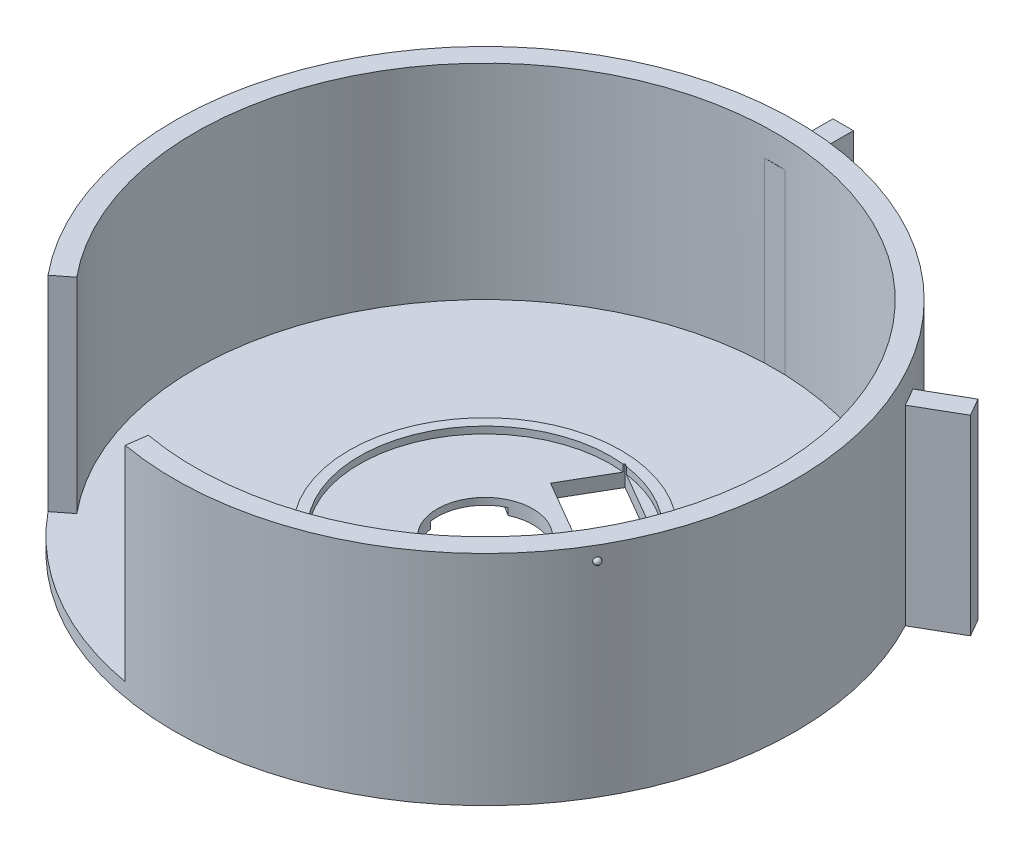
from build123d import *

# Parameters (mm, degrees)
SKETCH1_R                = 45.5
SKETCH1_R_2              = 42.5
BOSS_EXTRUDE1_DEPTH      = 32
SKETCH2_R                = 45.5
BOSS_EXTRUDE2_DEPTH      = 2
SKETCH3_R                = 7
CUT_EXTRUDE1_DEPTH       = 2
BOSS_EXTRUDE4_DEPTH      = 26
BOSS_EXTRUDE4_DEPTH_BACK = 2
SKETCH7_W                = 3
SKETCH7_H                = 10
SKETCH8_R                = 19.890165718
SKETCH8_R_2              = 18.390165718
BOSS_EXTRUDE5_DEPTH      = 1
CUT_EXTRUDE4_DEPTH       = 5.5
CUT_EXTRUDE5_DEPTH       = 58.5
CUT_EXTRUDE6_DEPTH       = 1
BOSS_EXTRUDE6_DEPTH      = 0.5
BOSS_EXTRUDE6_DEPTH_BACK = 2
SKETCH13_R               = 0.5
FILLET1_R                = 0.5
BOSS_EXTRUDE7_START      = -2
SKETCH23_R               = 0.5
BOSS_EXTRUDE7_DEPTH      = 2.5
FILLET2_R                = 0.5
FILLET2_OF_MIRROR1_R     = 0.5


with BuildPart() as part:
    # Sketch1 → Boss-Extrude1 (new body)
    with BuildSketch(Plane(origin=(0, 0, 0), x_dir=(1, 0, 0), z_dir=(0, 1, 0))):
        with Locations(Location((0, 0, 0), (0, 0, 270))):
            Circle(SKETCH1_R)
        with Locations(Location((0, 0, 0), (0, 0, 270))):
            Circle(SKETCH1_R_2, mode=Mode.SUBTRACT)
    extrude(amount=BOSS_EXTRUDE1_DEPTH)

    # Sketch2 → Boss-Extrude2 (add)
    with BuildSketch(Plane.XZ):
        with Locations(Location((0, 0, 0), (0, 0, 90))):
            Circle(SKETCH2_R)
    extrude(amount=-BOSS_EXTRUDE2_DEPTH)

    # Sketch3 → Cut-Extrude1 (cut)
    with BuildSketch(Plane(origin=(0, 2, 0), x_dir=(1, 0, 0), z_dir=(0, 1, 0))):
        with Locations(Location((0, 0, 0), (0, 0, 270))):
            Circle(SKETCH3_R)
    extrude(amount=-CUT_EXTRUDE1_DEPTH, mode=Mode.SUBTRACT)

    # Sketch7 → Boss-Extrude4 (add, two sides: drawn at the far end of the back side and taken through both)
    with BuildSketch(Plane(origin=(0, 2, 0), x_dir=(1, 0, 0), z_dir=(0, 1, 0)).offset(-BOSS_EXTRUDE4_DEPTH_BACK)):
        with Locations((0, 47.473521163)):
            Rectangle(SKETCH7_W, SKETCH7_H)
        Polygon((46.193402353, 24.937722476), (37.533148315, 19.937722476), (36.033148315, 22.535798687), (44.693402353, 27.535798687), align=None)
    extrude(amount=BOSS_EXTRUDE4_DEPTH + BOSS_EXTRUDE4_DEPTH_BACK)

    # Sketch8 → Boss-Extrude5 (add)
    with BuildSketch(Plane(origin=(0, 2, 0), x_dir=(1, 0, 0), z_dir=(0, 1, 0))):
        with Locations(Location((0, 0, 0), (0, 0, 90))):
            Circle(SKETCH8_R)
        with Locations(Location((0, 0, 0), (0, 0, 270))):
            Circle(SKETCH8_R_2, mode=Mode.SUBTRACT)
    extrude(amount=BOSS_EXTRUDE5_DEPTH)

    # Sketch10 → Cut-Extrude4 (cut)
    with BuildSketch(Plane.XZ):
        Polygon((2.06668842, -18.465611254), (15.0318685, -10.92213026), (11.008678636, -4.007367551), (-1.956501443, -11.550848545), align=None)
    extrude(amount=-CUT_EXTRUDE4_DEPTH, mode=Mode.SUBTRACT)

    # Sketch11 → Cut-Extrude5 (cut)
    with BuildSketch(Plane(origin=(0, 2, 0), x_dir=(1, 0, 0), z_dir=(0, 1, 0))):
        Polygon((-32.606600292, -26.874098434), (-35.165226496, -28.87311631), (-33.824988888, -37.754161376), (-11.7382848, -48.772412552), (-7.925983096, -44.804338986), (-7.495155029, -41.738838001), (-9.978475631, -35.419229659), (-25.965270809, -26.874098434), align=None)
    extrude(amount=CUT_EXTRUDE5_DEPTH, mode=Mode.SUBTRACT)

    # Sketch12 → Cut-Extrude6 (cut)
    with BuildSketch(Plane.XZ):
        Polygon((-6.912265346, 1.104802147), (-24.20763883, -9.480307189), (-19.814483018, -16.658435267), (-2.519109534, -6.073325931), align=None)
    extrude(amount=-CUT_EXTRUDE6_DEPTH, mode=Mode.SUBTRACT)

    # Sketch23 → Boss-Extrude7 (add)
    with BuildSketch(Plane(origin=(39.327712908, 0, 22.881892348), x_dir=(0.5028987329328956, 0, -0.8643453386317811), z_dir=(0.8643453386317811, 0, 0.5028987329328956)).offset(BOSS_EXTRUDE7_START)):
        with Locations((0, 30)):
            Circle(SKETCH23_R)
    boss_extrude7 = extrude(amount=BOSS_EXTRUDE7_DEPTH)

    # Fillet2
    fillet2_edges = [part.edges().sort_by_distance(p)[0] for p in [
        (39.508436211, 30, 23.565514384),
    ]]
    fillet(fillet2_edges, radius=FILLET2_R - 0.0001)  # a hair under: the kernel refuses the full size

    # Mirror1: Boss-Extrude7 across plane
    add(boss_extrude7.mirror(Plane(origin=(0, 0, 0), x_dir=(-0.5028987329328956, 0, 0.864345338631781), z_dir=(0.8643453386317811, 0, 0.5028987329328956))))

    # Fillet2 of Mirror1
    fillet2_of_mirror1_edges = [part.edges().sort_by_distance(p)[0] for p in [
        (-40.011334944, 30, -22.701169046),
    ]]
    fillet(fillet2_of_mirror1_edges, radius=FILLET2_OF_MIRROR1_R - 0.0001)  # a hair under: the kernel refuses the full size


with BuildPart() as body_2:
    # Sketch13 → Boss-Extrude6 (new, two sides: drawn at the far end of the back side and taken through both)
    with BuildSketch(Plane(origin=(22.831602475, 0, -39.241278374), x_dir=(-0.8643453386317811, 0, -0.5028987329328956), z_dir=(0.5028987329328954, 0, -0.864345338631781)).offset(-BOSS_EXTRUDE6_DEPTH_BACK)):
        with Locations((0, 30)):
            Circle(SKETCH13_R)
    extrude(amount=BOSS_EXTRUDE6_DEPTH + BOSS_EXTRUDE6_DEPTH_BACK)

    # Fillet1
    fillet1_edges = [body_2.edges().sort_by_distance(p)[0] for p in [
        (23.515224511, 30, -39.422001677),
    ]]
    fillet(fillet1_edges, radius=FILLET1_R - 0.0001)  # a hair under: the kernel refuses the full size


solid = Compound([part.part, body_2.part])
